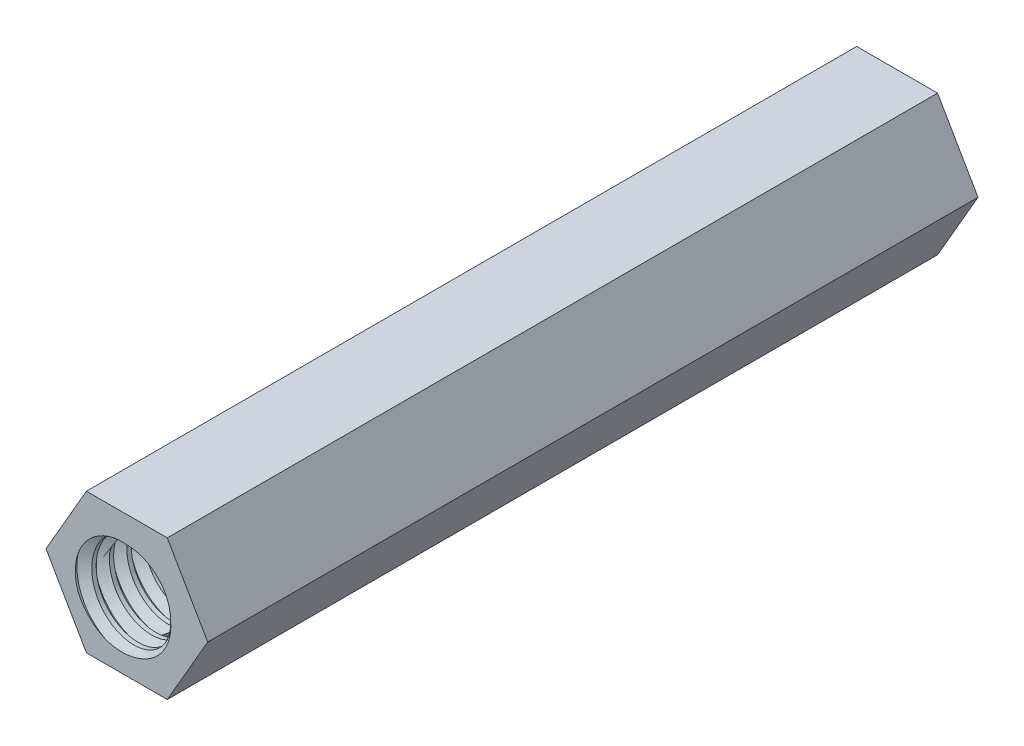
from build123d import *

# Parameters (mm, degrees)
BOSS_EXTRUDE1_DEPTH                     = 22
CUT_EXTRUDE1_DEPTH                      = 23.211108332
CUT_EXTRUDE1_DEPTH_BACK                 = 23.211108332
SKETCH2_R                               = 1.25
THREAD_M3X0_5_INTERNAL_THROUGH_RH_PITCH = 0.5


with BuildPart() as part:
    # Sketch1 → Boss-Extrude1 (new body)
    with BuildSketch(Plane.XY):
        Polygon((2.309401077, 0), (1.154700538, 2), (-1.154700538, 2), (-2.309401077, 0), (-1.154700538, -2), (1.154700538, -2), align=None)
    extrude(amount=-BOSS_EXTRUDE1_DEPTH)

    # Sketch2 → Cut-Extrude1 (cut, two sides: drawn at the far end of the back side and taken through both)
    with BuildSketch(Plane.XY.offset(-CUT_EXTRUDE1_DEPTH_BACK)):
        Circle(SKETCH2_R)
    extrude(amount=CUT_EXTRUDE1_DEPTH + CUT_EXTRUDE1_DEPTH_BACK, mode=Mode.SUBTRACT)

    # Thread_M3x0.5_Internal_Through_RH: the profile of Thread Profile1 profile screwed along a right-hand helix of 44 turns, 6 arcs to a turn; built about Z, then put on its axis
    thread_m3x0_5_internal_through_rh_z = Axis((0, 0, 0), (0, 0, 1))
    thread_m3x0_5_internal_through_rh_corners = [(1.2497, 0, -0.000173205), (1.520632938, 0, 0.156249999), (1.520632937, 0, 0.218749999), (1.2497, 0, 0.375173204)]
    with BuildLine(mode=Mode.PRIVATE) as thread_m3x0_5_internal_through_rh_profile:
        Line(thread_m3x0_5_internal_through_rh_corners[0], thread_m3x0_5_internal_through_rh_corners[1])
        Line(thread_m3x0_5_internal_through_rh_corners[1], thread_m3x0_5_internal_through_rh_corners[2])
        Line(thread_m3x0_5_internal_through_rh_corners[2], thread_m3x0_5_internal_through_rh_corners[3])
        Line(thread_m3x0_5_internal_through_rh_corners[3], thread_m3x0_5_internal_through_rh_corners[0])
    thread_m3x0_5_internal_through_rh_cap = Face(thread_m3x0_5_internal_through_rh_profile.wire())
    thread_m3x0_5_internal_through_rh_turn_angles = [0, 30, 60, 90, 120, 150, 180, 210, 240, 270, 300, 330, 360, 390, 420, 450, 480, 510, 540, 570, 600, 630, 660, 690, 720]
    thread_m3x0_5_internal_through_rh_turn_weights = [1, 0.8660254037844387, 1, 0.8660254037844387, 1, 0.8660254037844387, 1, 0.8660254037844387, 1, 0.8660254037844387, 1, 0.8660254037844387, 1, 0.8660254037844387, 1, 0.8660254037844387, 1, 0.8660254037844387, 1, 0.8660254037844387, 1, 0.8660254037844387, 1, 0.8660254037844387, 1]
    thread_m3x0_5_internal_through_rh_turn_rails = [Edge.make_bspline([Vector(p[0], p[1], 0).rotate(thread_m3x0_5_internal_through_rh_z, thread_m3x0_5_internal_through_rh_turn_angles[k]) / thread_m3x0_5_internal_through_rh_turn_weights[k] + Vector(0, 0, p[2] + THREAD_M3X0_5_INTERNAL_THROUGH_RH_PITCH * thread_m3x0_5_internal_through_rh_turn_angles[k] / 360) for k in range(25)], [0, 0, 0, 1, 1, 2, 2, 3, 3, 4, 4, 5, 5, 6, 6, 7, 7, 8, 8, 9, 9, 10, 10, 11, 11, 12, 12, 12], 2, thread_m3x0_5_internal_through_rh_turn_weights) for p in thread_m3x0_5_internal_through_rh_corners]
    thread_m3x0_5_internal_through_rh_turn_sides = [Face.make_surface_from_curves(thread_m3x0_5_internal_through_rh_turn_rails[p[0]], thread_m3x0_5_internal_through_rh_turn_rails[p[1]]) for p in [(0, 1), (1, 2), (2, 3), (3, 0)]]
    thread_m3x0_5_internal_through_rh = Plane(origin=(0, 0, -22), x_dir=(1, 0, 0), z_dir=(0, 0, 1)) * Solid(Shell([*[p.moved(Location((0, 0, 2 * THREAD_M3X0_5_INTERNAL_THROUGH_RH_PITCH * i))) for i in range(22) for p in thread_m3x0_5_internal_through_rh_turn_sides], thread_m3x0_5_internal_through_rh_cap, thread_m3x0_5_internal_through_rh_cap.rotate(thread_m3x0_5_internal_through_rh_z, 15840).moved(Location((0, 0, THREAD_M3X0_5_INTERNAL_THROUGH_RH_PITCH * 15840 / 360)))]))
    add(thread_m3x0_5_internal_through_rh, mode=Mode.SUBTRACT)


solid = part.part
